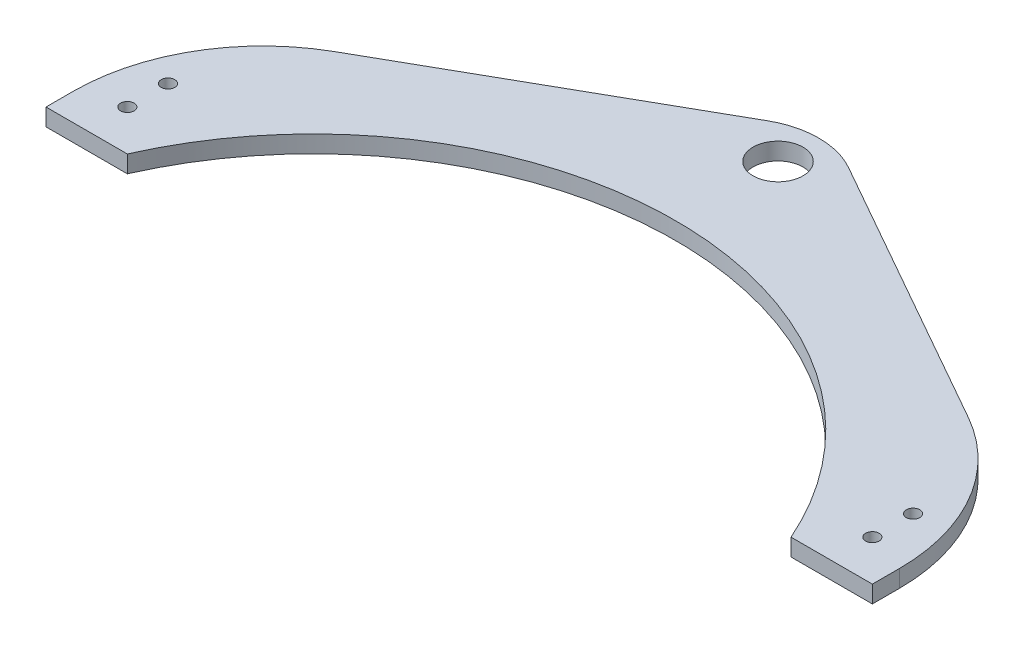
from build123d import *

# Parameters (mm, degrees)
SKETCH1_R           = 4.6
SKETCH1_R_2         = 1.25
BOSS_EXTRUDE2_DEPTH = 3.175


with BuildPart() as part:
    # Sketch1 → Boss-Extrude2 (new body)
    with BuildSketch(Plane(origin=(0, 0, 0), x_dir=(1, 0, 0), z_dir=(0, 1, 0))):
        with BuildLine():
            Line((-7.5, 0), (0, 0))
            ThreePointArc((0, 0), (61.2, 39.907584028), (122.4, 0))
            Line((122.4, 0), (129.9, 0))
            Line((129.9, 0), (137.4, 0))
            Line((137.4, 0), (137.4, 5.001196831))
            ThreePointArc((137.4, 5.001196831), (132.638976527, 22.625166265), (119.651182936, 35.45438529))
            Line((119.651182936, 35.45438529), (68.639886063, 64.351366482))
            ThreePointArc((68.639886063, 64.351366482), (65.069446402, 65.804662996), (61.246521948, 66.3))
            Line((61.246521948, 66.3), (61.153478052, 66.3))
            ThreePointArc((61.153478052, 66.3), (57.330553598, 65.804662996), (53.760113937, 64.351366482))
            Line((53.760113937, 64.351366482), (2.748817064, 35.45438529))
            ThreePointArc((2.748817064, 35.45438529), (-10.238976527, 22.625166265), (-15, 5.001196831))
            Line((-15, 5.001196831), (-15, 0))
            Line((-15, 0), (-7.5, 0))
        make_face()
        with Locations((61.2, 58.8)):
            Circle(SKETCH1_R, mode=Mode.SUBTRACT)
        with BuildLine():
            ThreePointArc((-7.5, 6.25), (-8.75, 7.5), (-7.5, 8.75))
            ThreePointArc((-7.5, 8.75), (-6.25, 7.5), (-7.5, 6.25))
        make_face(mode=Mode.SUBTRACT)
        with Locations((-7.5, 15)):
            Circle(SKETCH1_R_2, mode=Mode.SUBTRACT)
        with BuildLine():
            ThreePointArc((129.9, 6.25), (128.65, 7.5), (129.9, 8.75))
            ThreePointArc((129.9, 8.75), (131.15, 7.5), (129.9, 6.25))
        make_face(mode=Mode.SUBTRACT)
        with Locations((129.9, 15)):
            Circle(SKETCH1_R_2, mode=Mode.SUBTRACT)
    extrude(amount=BOSS_EXTRUDE2_DEPTH)


solid = part.part
